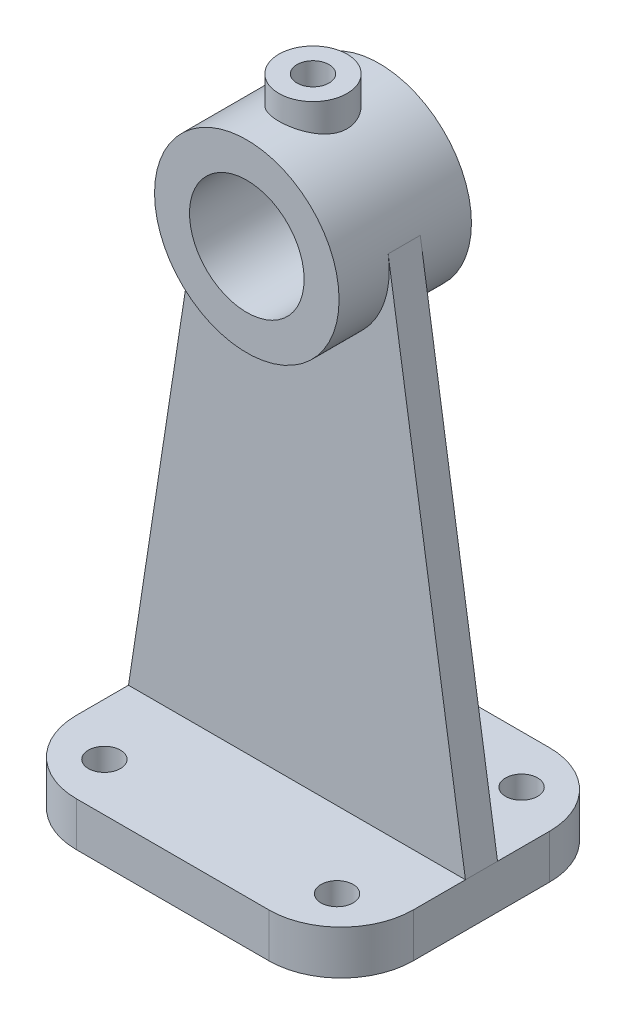
from build123d import *
from build123d.topology import SkipClean

# Parameters (mm, degrees)
SKETCH1_W                = 84
SKETCH1_H                = 70
BOSS_EXTRUDE1_DEPTH      = 11
SKETCH2_R                = 4
CUT_EXTRUDE1_DEPTH       = 56.767373974
FILLET1_R                = 18
BOSS_EXTRUDE2_DEPTH      = 4
SKETCH3_3_R              = 23
SKETCH3_3_R_2            = 14.285
BOSS_EXTRUDE3_DEPTH      = 16.5
CUT_EXTRUDE2_DEPTH       = 166.302752548
CUT_EXTRUDE2_DEPTH_BACK  = 166.302752548
SKETCH3_4_R              = 14.285
BOSS_EXTRUDE4_REACH      = 172.977
BOSS_EXTRUDE4_END_RADIUS = 23
SKETCH5_R                = 8.5
SKETCH5_R_2              = 4
CUT_EXTRUDE4_OUTLINE_W   = 4
CUT_EXTRUDE4_OUTLINE_H   = 15.28653943


# Read off the part's stored shape, not the designer's step: Cut-Extrude4
with BuildPart() as part:
    # Sketch1 → Boss-Extrude1 (new body)
    with BuildSketch(Plane(origin=(0, 0, 0), x_dir=(1, 0, 0), z_dir=(0, 1, 0))):
        Rectangle(SKETCH1_W, SKETCH1_H)
    extrude(amount=BOSS_EXTRUDE1_DEPTH)

    # Sketch2 → Cut-Extrude1 (cut, through all)
    with BuildSketch(Plane(origin=(0, 11, 0), x_dir=(1, 0, 0), z_dir=(0, 1, 0))):
        with Locations(Location((29, 23, 0), (0, 0, 270))):
            Circle(SKETCH2_R)
        with Locations(Location((29, -23, 0), (0, 0, 270))):
            Circle(SKETCH2_R)
        with Locations(Location((-29, -23, 0), (0, 0, 90))):
            Circle(SKETCH2_R)
        with Locations(Location((-29, 23, 0), (0, 0, 90))):
            Circle(SKETCH2_R)
    extrude(amount=-CUT_EXTRUDE1_DEPTH, mode=Mode.SUBTRACT)

    # Fillet1
    fillet1_edges = [part.edges().sort_by_distance(p)[0] for p in [
        (42, 5.5, 35),
        (-42, 5.5, 35),
        (-42, 5.5, -35),
        (42, 5.5, -35),
    ]]
    fillet(fillet1_edges, radius=FILLET1_R)

    # Sketch3 → Boss-Extrude2 (add, symmetric)
    with BuildSketch(Plane.XY):
        with BuildLine():
            Line((-22.733632294, 136.490266855), (-42, 11))
            Line((-42, 11), (-24, 11))
            Line((-24, 11), (24, 11))
            Line((24, 11), (42, 11))
            Line((42, 11), (22.733632294, 136.490266855))
            ThreePointArc((22.733632294, 136.490266855), (22.933311392, 134.750208164), (23, 133))
            ThreePointArc((23, 133), (-1.750208164, 110.066688608), (-22.733632294, 136.490266855))
        make_face()
    extrude(amount=BOSS_EXTRUDE2_DEPTH, both=True)


with BuildPart() as body_2:
    # Sketch3<3> → Boss-Extrude3 (new, symmetric)
    # profile 1 of 2: a face of its own
    with BuildSketch(Plane.XY):
        with Locations((0, 133)):
            Circle(SKETCH3_3_R)
        with Locations((0, 133)):
            Circle(SKETCH3_3_R_2, mode=Mode.SUBTRACT)
    # profile 2 of 2: a face of its own
    with BuildSketch(Plane.XY):
        with Locations((0, 133)):
            Circle(SKETCH3_3_R_2)
    extrude(amount=BOSS_EXTRUDE3_DEPTH, both=True)

    # Sketch3<4> → Cut-Extrude2 (cut, two sides: drawn at the far end of the back side and taken through both)
    with BuildSketch(Plane.XY.offset(-CUT_EXTRUDE2_DEPTH_BACK)):
        with Locations((0, 133)):
            Circle(SKETCH3_4_R)
    extrude(amount=CUT_EXTRUDE2_DEPTH + CUT_EXTRUDE2_DEPTH_BACK, mode=Mode.SUBTRACT)

    # Boss-Extrude4: up to this cylinder (the profile starts outside it)
    boss_extrude4_end = Plane(origin=(0, 133, -8.259584), z_dir=(0, 0, -1)) * Cylinder(BOSS_EXTRUDE4_END_RADIUS, 392.954, mode=Mode.PRIVATE)
    # Sketch5 → Boss-Extrude4 (add, up to the surface)
    with BuildSketch(Plane(origin=(0, 162, 0), x_dir=(-1, 0, 0), z_dir=(0, -1, 0)), mode=Mode.PRIVATE) as boss_extrude4_sk1:
        with Locations(Location((0, 0, 0), (0, 0, 270))):
            Circle(SKETCH5_R)
        with Locations(Location((0, 0, 0), (0, 0, 270))):
            Circle(SKETCH5_R_2, mode=Mode.SUBTRACT)
    boss_extrude4_tool1 = extrude(boss_extrude4_sk1.sketch, amount=BOSS_EXTRUDE4_REACH, mode=Mode.PRIVATE) - boss_extrude4_end
    add(boss_extrude4_tool1.solids().sort_by_distance((0, 162, -8.259584))[0])

    # Cut-Extrude4 outline → Cut-Extrude4 (revolve, cut)
    with SkipClean():  # the faces are left unmerged after this step: merging them gives an invalid solid
        with BuildSketch(Plane.XY):
            with Locations((2, 154.356730285)):
                Rectangle(CUT_EXTRUDE4_OUTLINE_W, CUT_EXTRUDE4_OUTLINE_H)
        revolve(axis=Axis((0, 0, 0), (0, 1, 0)), mode=Mode.SUBTRACT)


solid = Compound([part.part, body_2.part])
